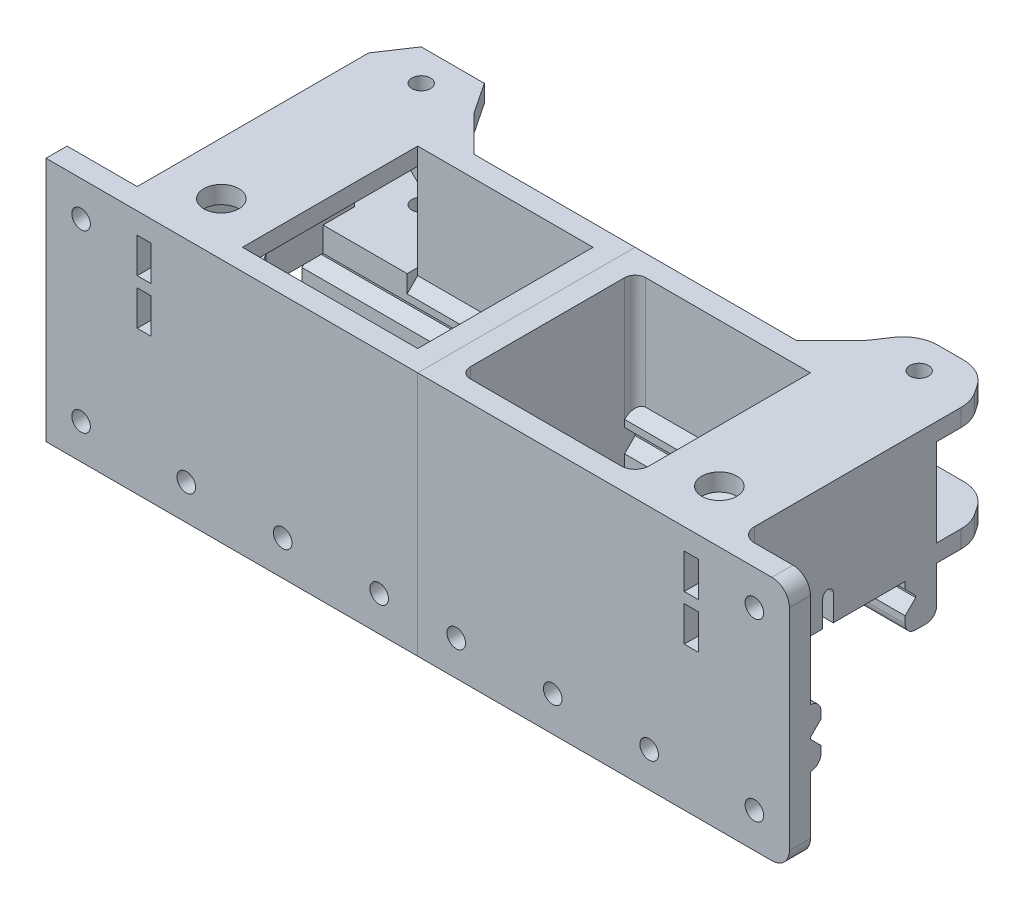
from build123d import *

# Parameters (mm, degrees)
SKETCH1_W                        = 50
SKETCH1_H                        = 70
BOSS_EXTRUDE1_DEPTH              = 6
SKETCH3_W                        = 4
SKETCH3_H                        = 10
CUT_EXTRUDE1_DEPTH               = 44.428101501
BOSS_EXTRUDE3_START              = -13
SKETCH4_R                        = 2.65
BOSS_EXTRUDE3_DEPTH              = 5
BOSS_EXTRUDE4_START              = -30
SKETCH4_3_R                      = 2.65
BOSS_EXTRUDE4_DEPTH              = 5
SKETCH5_R                        = 2.65
CUT_EXTRUDE2_DEPTH               = 47.626172907
SKETCH6_W                        = 4
SKETCH6_H                        = 10
CUT_EXTRUDE3_DEPTH               = 50.254441424
BOSS_EXTRUDE6_DEPTH              = 50
BOSS_EXTRUDE6_DIRECTION_2_REACH  = 65.632
BOSS_EXTRUDE7_DEPTH              = 70
SKETCH12_W                       = 62
SKETCH12_H                       = 16.5
BOSS_EXTRUDE8_DEPTH              = 6
SKETCH13_W                       = 6
SKETCH13_H                       = 3
BOSS_EXTRUDE9_DEPTH              = 48.5
SKETCH14_W                       = 50
SKETCH14_H                       = 6.5
CUT_EXTRUDE5_DEPTH               = 46
BOSS_EXTRUDE10_DEPTH             = 22
BOSS_EXTRUDE10_DEPTH_BACK        = 6
SKETCH15_W                       = 30
SKETCH15_H                       = 5
SKETCH16_R                       = 2.65
CUT_EXTRUDE6_DEPTH               = 38
SKETCH17_W                       = 4
SKETCH17_H                       = 24
CUT_EXTRUDE7_DEPTH               = 68
BOSS_EXTRUDE11_START             = 75
SKETCH19_W                       = 30
SKETCH19_H                       = 5
BOSS_EXTRUDE11_DEPTH             = 28
SKETCH20_R                       = 2.65
CUT_EXTRUDE9_DEPTH               = 116.805872045
SKETCH22_W                       = 30
SKETCH22_H                       = 47
BOSS_EXTRUDE12_DEPTH             = 5
SKETCH40_W                       = 4
SKETCH40_H                       = 1
CUT_EXTRUDE20_DEPTH              = 20
BOSS_EXTRUDE14_REACH             = 132.713
BOSS_EXTRUDE20_REACH             = 106.508
SKETCH41_W                       = 20
SKETCH41_H                       = 7
BOSS_EXTRUDE20_DIRECTION_2_REACH = 106.508
CHAMFER1_SIZE                    = 3
SKETCH34_W                       = 62
SKETCH34_H                       = 16
SKETCH34_R                       = 2.65
BOSS_EXTRUDE18_DEPTH             = 6
SKETCH35_W                       = 6
SKETCH35_H                       = 21.5
BOSS_EXTRUDE19_DEPTH             = 56
SKETCH46_W                       = 7.451156618
SKETCH46_H                       = 44
CUT_EXTRUDE22_DEPTH              = 10
SKETCH36_R                       = 2.65
CUT_EXTRUDE16_DEPTH              = 13
CHAMFER2_SIZE                    = 10
CHAMFER3_SIZE                    = 3
CHAMFER4_SIZE                    = 10
FILLET1_R                        = 10
SKETCH47_R                       = 5
CUT_EXTRUDE23_DEPTH              = 10
BOSS_EXTRUDE46_DEPTH             = 32
SKETCH79_R                       = 10.5
CUT_EXTRUDE30_DEPTH              = 12
FILLET6_R                        = 5
BOSS_EXTRUDE43_DEPTH             = 0.4
SKETCH82_W                       = 9
SKETCH82_H                       = 25
BOSS_EXTRUDE44_DEPTH             = 0.2
FILLET7_R                        = 3
CUT_EXTRUDE31_DEPTH              = 5.6
SKETCH84_W                       = 47
SKETCH84_H                       = 25
CUT_EXTRUDE32_DEPTH              = 2
BOSS_EXTRUDE45_DEPTH             = 0.4
SKETCH86_W                       = 44
SKETCH86_H                       = 2
CUT_EXTRUDE33_DEPTH              = 10.4
FILLET8_R                        = 10
FILLET9_R                        = 3
FILLET10_R                       = 4
CUT_EXTRUDE34_START              = -1
CUT_EXTRUDE34_DEPTH              = 1


with BuildPart() as part:
    # Sketch1 → Boss-Extrude1 (new body)
    with BuildSketch(Plane.XY):
        Rectangle(SKETCH1_W, SKETCH1_H)
    extrude(amount=BOSS_EXTRUDE1_DEPTH)

    # Sketch3 → Cut-Extrude1 (cut, through all)
    with BuildSketch(Plane.XY.offset(6)):
        with Locations((3, 24)):
            Rectangle(SKETCH3_W, SKETCH3_H)
    extrude(amount=-CUT_EXTRUDE1_DEPTH, mode=Mode.SUBTRACT)

    # Sketch4 → Boss-Extrude3 (add)
    # profile 1 of 2: a face of its own
    with BuildSketch(Plane(origin=(0, 35, 0), x_dir=(1, 0, 0), z_dir=(0, 1, 0)).offset(BOSS_EXTRUDE3_START)):
        with BuildLine():
            ThreePointArc((17.941176471, 13.235294118), (14.630461799, 16.717436331), (10, 18))
            ThreePointArc((10, 18), (5.369538201, 16.717436331), (2.058823529, 13.235294118))
            Line((2.058823529, 13.235294118), (-5, 0))
            Line((-5, 0), (25, 0))
            Line((25, 0), (17.941176471, 13.235294118))
        make_face()
        with Locations(Location((10, 9, 0), (0, 0, 270))):
            Circle(SKETCH4_R, mode=Mode.SUBTRACT)
    # profile 2 of 2: a face of its own
    with BuildSketch(Plane(origin=(0, 35, 0), x_dir=(1, 0, 0), z_dir=(0, 1, 0)).offset(BOSS_EXTRUDE3_START)):
        with BuildLine():
            ThreePointArc((2.058823529, 13.235294118), (5.369538201, 16.717436331), (10, 18))
            Line((10, 18), (-5, 18))
            Line((-5, 18), (-5, 0))
            Line((-5, 0), (2.058823529, 13.235294118))
        make_face()
    extrude(amount=-BOSS_EXTRUDE3_DEPTH)

    # Sketch4<3> → Boss-Extrude4 (add)
    # profile 1 of 2: a face of its own
    with BuildSketch(Plane(origin=(0, 35, 0), x_dir=(1, 0, 0), z_dir=(0, 1, 0)).offset(BOSS_EXTRUDE4_START)):
        with BuildLine():
            ThreePointArc((2.058823529, 13.235294118), (5.369538201, 16.717436331), (10, 18))
            Line((10, 18), (-5, 18))
            Line((-5, 18), (-5, 0))
            Line((-5, 0), (2.058823529, 13.235294118))
        make_face()
    # profile 2 of 2: a face of its own
    with BuildSketch(Plane(origin=(0, 35, 0), x_dir=(1, 0, 0), z_dir=(0, 1, 0)).offset(BOSS_EXTRUDE4_START)):
        with BuildLine():
            ThreePointArc((17.941176471, 13.235294118), (14.630461799, 16.717436331), (10, 18))
            ThreePointArc((10, 18), (5.369538201, 16.717436331), (2.058823529, 13.235294118))
            Line((2.058823529, 13.235294118), (-5, 0))
            Line((-5, 0), (25, 0))
            Line((25, 0), (17.941176471, 13.235294118))
        make_face()
        with Locations(Location((10, 9, 0), (0, 0, 270))):
            Circle(SKETCH4_3_R, mode=Mode.SUBTRACT)
    extrude(amount=-BOSS_EXTRUDE4_DEPTH)

    # Sketch5 → Cut-Extrude2 (cut, through all)
    with BuildSketch(Plane(origin=(0, 0, 0), x_dir=(-1, 0, 0), z_dir=(0, 0, -1))):
        with Locations((15, 25)):
            Circle(SKETCH5_R)
        with Locations((15, -25)):
            Circle(SKETCH5_R)
        with Locations((-15, -25)):
            Circle(SKETCH5_R)
    extrude(amount=-CUT_EXTRUDE2_DEPTH, mode=Mode.SUBTRACT)

    # Sketch6 → Cut-Extrude3 (cut, through all)
    with BuildSketch(Plane.XY.offset(6)):
        with Locations((3, 11)):
            Rectangle(SKETCH6_W, SKETCH6_H)
    extrude(amount=-CUT_EXTRUDE3_DEPTH, mode=Mode.SUBTRACT)

    # Sketch9 → Boss-Extrude6 (add)
    with BuildSketch(Plane(origin=(25, 0, 0), x_dir=(0, 0, -1), z_dir=(1, 0, 0))):
        Polygon((0, -2), (3, -2), (3, 3), (-6, 3), (-6, 8.003800923), (-6, 6.5), (-6, -13.5), (3, -13.5), (3, -8.5), (0, -8.5), align=None)
    extrude(amount=BOSS_EXTRUDE6_DEPTH)

    # Boss-Extrude6 direction 2: up to this face of the body (flat: up to its plane)
    boss_extrude6_direction_2_end = Plane(part.part.faces().sort_by_distance((-25, 0, 3))[0])
    # Sketch9 → Boss-Extrude6 direction 2 (add, up to the picked face)
    with BuildSketch(Plane(origin=(25, 0, 0), x_dir=(0, 0, -1), z_dir=(1, 0, 0)), mode=Mode.PRIVATE) as boss_extrude6_direction_2_sk1:
        Polygon((0, -2), (3, -2), (3, 3), (-6, 3), (-6, 8.003800923), (-6, 6.5), (-6, -13.5), (3, -13.5), (3, -8.5), (0, -8.5), align=None)
    boss_extrude6_direction_2_tool1 = split(extrude(boss_extrude6_direction_2_sk1.sketch, amount=-BOSS_EXTRUDE6_DIRECTION_2_REACH, mode=Mode.PRIVATE), bisect_by=boss_extrude6_direction_2_end, keep=Keep.BOTH, mode=Mode.PRIVATE)
    add(boss_extrude6_direction_2_tool1.solids().sort_by(Axis((25, -5.25, 1.953488), (-1, 0, 0)))[0])



with BuildPart() as body_2:
    # Sketch10 → Boss-Extrude7 (new body)
    with BuildSketch(Plane(origin=(75, 0, 0), x_dir=(0, 0, -1), z_dir=(1, 0, 0))):
        Polygon((47, 3), (56, 3), (56, -13.5), (47, -13.5), (47, -8.5), (50, -8.5), (50, -2), (47, -2), align=None)
    extrude(amount=-BOSS_EXTRUDE7_DEPTH)


with BuildPart() as part_1:
    add(part.part)

    add(body_2.part)  # Boss-Extrude8 merges body 2
    # Sketch12 → Boss-Extrude8 (add)
    with BuildSketch(Plane(origin=(75, 0, 0), x_dir=(0, 0, -1), z_dir=(1, 0, 0))):
        with Locations((25, -5.25)):
            Rectangle(SKETCH12_W, SKETCH12_H)
    extrude(amount=BOSS_EXTRUDE8_DEPTH)

    # Sketch13 → Boss-Extrude9 (add)
    with BuildSketch(Plane.XZ.offset(13.5)):
        Polygon((-5, 0), (1, 0), (1, -47), (5, -47), (5, -56), (-5, -56), align=None)
        with Locations((-2, -1.5)):
            Rectangle(SKETCH13_W, SKETCH13_H)
    extrude(amount=-BOSS_EXTRUDE9_DEPTH)

    # Sketch14 → Cut-Extrude5 (cut)
    with BuildSketch(Plane(origin=(5, 0, 0), x_dir=(0, 0, -1), z_dir=(1, 0, 0))):
        with Locations((25, -5.25)):
            Rectangle(SKETCH14_W, SKETCH14_H)
    extrude(amount=-CUT_EXTRUDE5_DEPTH, mode=Mode.SUBTRACT)

    # Sketch15 → Boss-Extrude10 (add, two sides: drawn at the far end of the back side and taken through both)
    with BuildSketch(Plane(origin=(0, 0, -56), x_dir=(-1, 0, 0), z_dir=(0, 0, -1)).offset(-BOSS_EXTRUDE10_DEPTH_BACK)):
        with Locations((-10, 2.5)):
            Rectangle(SKETCH15_W, SKETCH15_H)
    extrude(amount=BOSS_EXTRUDE10_DEPTH + BOSS_EXTRUDE10_DEPTH_BACK)

    # Sketch16 → Cut-Extrude6 (cut)
    with BuildSketch(Plane(origin=(0, 35, 0), x_dir=(1, 0, 0), z_dir=(0, 1, 0))):
        with Locations(Location((10, 66, 0), (0, 0, 270))):
            Circle(SKETCH16_R)
        Polygon((-11.950245161, 66), (-5, 66), (1, 75), (19, 75), (25, 66), (29.066568536, 63), (29.066568536, 83.252685977), (-11.950245161, 83.252685977), align=None)
    extrude(amount=-CUT_EXTRUDE6_DEPTH, mode=Mode.SUBTRACT)

    # Sketch17 → Cut-Extrude7 (cut)
    with BuildSketch(Plane(origin=(0, 0, 0), x_dir=(-1, 0, 0), z_dir=(0, 0, -1))):
        with Locations((-3, 18)):
            Rectangle(SKETCH17_W, SKETCH17_H)
    extrude(amount=CUT_EXTRUDE7_DEPTH, mode=Mode.SUBTRACT)

    # Sketch19 → Boss-Extrude11 (add)
    with BuildSketch(Plane(origin=(0, 0, 0), x_dir=(-1, 0, 0), z_dir=(0, 0, -1)).offset(BOSS_EXTRUDE11_START)):
        with Locations((-10, 32.5)):
            Rectangle(SKETCH19_W, SKETCH19_H)
    extrude(amount=-BOSS_EXTRUDE11_DEPTH)

    # Sketch20 → Cut-Extrude9 (cut, through all)
    with BuildSketch(Plane.XZ):
        with Locations(Location((10, -66, 0), (0, 0, 90))):
            Circle(SKETCH20_R)
        Polygon((-5, -66), (1, -75), (19, -75), (25, -66), (30.497094531, -66), (30.497094531, -85.505826408), (-19.333477305, -82.841089947), (-12.671636151, -66), align=None)
    extrude(amount=-CUT_EXTRUDE9_DEPTH, mode=Mode.SUBTRACT)

    # Sketch22 → Boss-Extrude12 (add)
    with BuildSketch(Plane(origin=(0, 35, 0), x_dir=(1, 0, 0), z_dir=(0, 1, 0))):
        with Locations((10, 23.5)):
            Rectangle(SKETCH22_W, SKETCH22_H)
    extrude(amount=-BOSS_EXTRUDE12_DEPTH)

    # Sketch40 → Cut-Extrude20 (cut)
    with BuildSketch(Plane(origin=(0, 0, -56), x_dir=(-1, 0, 0), z_dir=(0, 0, -1))):
        with Locations((-3, 5.5)):
            Rectangle(SKETCH40_W, SKETCH40_H)
    extrude(amount=-CUT_EXTRUDE20_DEPTH, mode=Mode.SUBTRACT)

    # Boss-Extrude14: up to this face of the body (flat: up to its plane)
    boss_extrude14_end = Plane(part_1.part.faces().sort_by_distance((-15, 3, -1.5))[0])
    # Sketch24 → Boss-Extrude14 (add, up to the picked face)
    with BuildSketch(Plane(origin=(0, 35, 0), x_dir=(1, 0, 0), z_dir=(0, 1, 0)), mode=Mode.PRIVATE) as boss_extrude14_sk1:
        Polygon((25, -6), (81, -6), (81, 56), (25, 56), (25, 53), (78, 53), (78, -3), (25, -3), align=None)
    boss_extrude14_tool1 = split(extrude(boss_extrude14_sk1.sketch, amount=-BOSS_EXTRUDE14_REACH, mode=Mode.PRIVATE), bisect_by=boss_extrude14_end, keep=Keep.BOTH, mode=Mode.PRIVATE)
    add(boss_extrude14_tool1.solids().sort_by(Axis((53, 35, 5.164536), (0, -1, 0)))[0])

    # Boss-Extrude20: up to this face of the body (flat: up to its plane)
    boss_extrude20_end = Plane(part_1.part.faces().sort_by_distance((37.259259259, 0.574074074, -47))[0])
    # Sketch41 → Boss-Extrude20 (add, up to the picked face)
    with BuildSketch(Plane.XY.offset(-50), mode=Mode.PRIVATE) as boss_extrude20_sk1:
        with Locations((15, 1.5)):
            Rectangle(SKETCH41_W, SKETCH41_H)
    boss_extrude20_tool1 = split(extrude(boss_extrude20_sk1.sketch, amount=BOSS_EXTRUDE20_REACH, mode=Mode.PRIVATE), bisect_by=boss_extrude20_end, keep=Keep.BOTH, mode=Mode.PRIVATE)
    add(boss_extrude20_tool1.solids().sort_by(Axis((15, 1.5, -50), (0, 0, 1)))[0])

    # Boss-Extrude20 direction 2: up to this face of the body (flat: up to its plane)
    boss_extrude20_direction_2_end = Plane(part_1.part.faces().sort_by_distance((-2, 17.5, -56))[0])
    # Sketch41 → Boss-Extrude20 direction 2 (add, up to the picked face)
    with BuildSketch(Plane.XY.offset(-50), mode=Mode.PRIVATE) as boss_extrude20_direction_2_sk1:
        with Locations((15, 1.5)):
            Rectangle(SKETCH41_W, SKETCH41_H)
    boss_extrude20_direction_2_tool1 = split(extrude(boss_extrude20_direction_2_sk1.sketch, amount=-BOSS_EXTRUDE20_DIRECTION_2_REACH, mode=Mode.PRIVATE), bisect_by=boss_extrude20_direction_2_end, keep=Keep.BOTH, mode=Mode.PRIVATE)
    add(boss_extrude20_direction_2_tool1.solids().sort_by(Axis((15, 1.5, -50), (0, 0, -1)))[0])

    # Chamfer1
    chamfer1_edges = [part_1.edges().sort_by_distance(p)[0] for p in [
        (25, -2, 0),
        (25, -8.5, 0),
        (49.2, 3, -3),
        (35, -2, -50),
        (35, -8.5, -50),
        (50, 3, -47),
    ]]
    chamfer(chamfer1_edges, length=CHAMFER1_SIZE)

    # Sketch34 → Boss-Extrude18 (add)
    with BuildSketch(Plane(origin=(81, 0, 0), x_dir=(0, 0, -1), z_dir=(1, 0, 0))):
        with Locations((25, -16.3)):
            Rectangle(SKETCH34_W, SKETCH34_H)
        with Locations(Location((25, -16.3, 0), (0, 0, 90))):
            Circle(SKETCH34_R, mode=Mode.SUBTRACT)
    extrude(amount=-BOSS_EXTRUDE18_DEPTH)

    # Sketch35 → Boss-Extrude19 (add)
    with BuildSketch(Plane(origin=(25, 0, 0), x_dir=(0, 0, -1), z_dir=(1, 0, 0))):
        with Locations((-3, -24.25)):
            Rectangle(SKETCH35_W, SKETCH35_H)
    extrude(amount=BOSS_EXTRUDE19_DEPTH)

    # Sketch46 → Cut-Extrude22 (cut)
    with BuildSketch(Plane.XZ.offset(13.5)):
        with Locations((-2.725578309, -25)):
            Rectangle(SKETCH46_W, SKETCH46_H)
    extrude(amount=-CUT_EXTRUDE22_DEPTH, mode=Mode.SUBTRACT)

    # Sketch36 → Cut-Extrude16 (cut)
    with BuildSketch(Plane(origin=(0, 0, 0), x_dir=(-1, 0, 0), z_dir=(0, 0, -1))):
        with BuildLine():
            ThreePointArc((-39.85, -25), (-42.5, -22.35), (-45.15, -25))
            Line((-45.15, -25), (-39.85, -25))
        make_face()
        with BuildLine():
            Line((-39.85, -25), (-45.15, -25))
            ThreePointArc((-45.15, -25), (-42.5, -27.65), (-39.85, -25))
        make_face()
        with Locations((-70, -25)):
            Circle(SKETCH36_R)
    extrude(amount=-CUT_EXTRUDE16_DEPTH, mode=Mode.SUBTRACT)

    # Chamfer2
    chamfer2_edges = [part_1.edges().sort_by_distance(p)[0] for p in [
        (25, 30, -54.5),
    ]]
    chamfer(chamfer2_edges, length=CHAMFER2_SIZE)

    # Chamfer3
    chamfer3_edges = [part_1.edges().sort_by_distance(p)[0] for p in [
        (25, 19, 3),
    ]]
    chamfer(chamfer3_edges, length=CHAMFER3_SIZE - 0.0001)  # a hair under: the kernel refuses the full size

    # Chamfer4
    # the kernel refuses this chamfer: 10 mm, written as the material it adds along each edge
    with BuildSketch(Plane(origin=(25, 0, -56), x_dir=(1, 0, 0), z_dir=(0, 1, 0))) as chamfer4_piece_1:
        Polygon((CHAMFER4_SIZE, 0), (0, CHAMFER4_SIZE), (0, 0), align=None)
    extrude(amount=5)
    with BuildSketch(Plane(origin=(25, -25.71682988, -56), x_dir=(1, 0, 0), z_dir=(0, 1, 0))) as chamfer4_piece_2_section:
        Polygon((CHAMFER4_SIZE, 0), (0, CHAMFER4_SIZE), (0, 0), align=None)
    chamfer4_piece_2 = extrude(amount=56.433659759, mode=Mode.PRIVATE)
    chamfer4_piece_2 = split(chamfer4_piece_2, bisect_by=Plane(origin=(25, 30, -56), z_dir=(0, 1, 0)), keep=Keep.TOP, mode=Mode.PRIVATE)
    add(chamfer4_piece_2)
    with BuildSketch(Plane(origin=(25, 35, -56), x_dir=(1, 0, 0), z_dir=(0, -1, 0))) as chamfer4_piece_3:
        Polygon((CHAMFER4_SIZE, 0), (0, -CHAMFER4_SIZE), (0, 0), align=None)
    extrude(amount=5)
    with BuildSketch(Plane(origin=(25, 60.71682988, -56), x_dir=(1, 0, 0), z_dir=(0, -1, 0))) as chamfer4_piece_4_section:
        Polygon((CHAMFER4_SIZE, 0), (0, -CHAMFER4_SIZE), (0, 0), align=None)
    chamfer4_piece_4 = extrude(amount=56.433659759, mode=Mode.PRIVATE)
    chamfer4_piece_4 = split(chamfer4_piece_4, bisect_by=Plane(origin=(25, 5, -56), z_dir=(0, -1, 0)), keep=Keep.TOP, mode=Mode.PRIVATE)
    add(chamfer4_piece_4)

    # Fillet1
    fillet1_edges = [part_1.edges().sort_by_distance(p)[0] for p in [
        (75, -13.5, -51.5),
    ]]
    fillet(fillet1_edges, radius=FILLET1_R)

    # Sketch47 → Cut-Extrude23 (cut)
    with BuildSketch(Plane(origin=(0, 35, 0), x_dir=(1, 0, 0), z_dir=(0, 1, 0))):
        with Locations(Location((10, 9, 0), (0, 0, 270))):
            Circle(SKETCH47_R)
    extrude(amount=-CUT_EXTRUDE23_DEPTH, mode=Mode.SUBTRACT)

    # Sketch89 → Boss-Extrude46 (add)
    with BuildSketch(Plane(origin=(0, 3, 0), x_dir=(1, 0, 0), z_dir=(0, 1, 0))):
        Polygon((75, 0), (25, 0), (28, -3), (78, -3), (78, 53), (25, 53), (25, 50), (75, 50), align=None)
    extrude(amount=BOSS_EXTRUDE46_DEPTH)


with BuildPart() as body_2_2:
    # Mirror1: mirrored copy
    add(part_1.part.mirror(Plane(origin=(81, 4.874203855, -24.516610226), x_dir=(0, 0, 1), z_dir=(1, 0, 0))))

    # Sketch79 → Cut-Extrude30 (cut)
    with BuildSketch(Plane.XZ.offset(-17)):
        with Locations((152, -9)):
            Circle(SKETCH79_R)
    extrude(amount=CUT_EXTRUDE30_DEPTH, mode=Mode.SUBTRACT)

    # Fillet6
    fillet6_edges = [body_2_2.edges().sort_by_distance(p)[0] for p in [
        (187, -35, 3),
        (187, 35, 3),
    ]]
    fillet(fillet6_edges, radius=FILLET6_R)

    # Sketch81 → Boss-Extrude43 (add)
    with BuildSketch(Plane.ZY.offset(-161)):
        Polygon((-47, 5), (-18, 5), (-18, 0), (-3, 0), (-3, -2), (-47, -2), align=None)
    extrude(amount=BOSS_EXTRUDE43_DEPTH)

    # Sketch82 → Boss-Extrude44 (add)
    with BuildSketch(Plane.ZY.offset(-161)):
        with Locations((-51.5, 17.5)):
            Rectangle(SKETCH82_W, SKETCH82_H)
    extrude(amount=BOSS_EXTRUDE44_DEPTH)

    # Fillet7
    fillet7_edges = [body_2_2.edges().sort_by_distance(p)[0] for p in [
        (157, 19.5, -18),
        (160.6, 2.5, -18),
    ]]
    fillet(fillet7_edges, radius=FILLET7_R)

    # Sketch83 → Cut-Extrude31 (cut)
    with BuildSketch(Plane(origin=(167, 0, 0), x_dir=(0, 0, -1), z_dir=(1, 0, 0))):
        with BuildLine():
            Line((26.5, 7.5), (26.5, -4.255908706))
            ThreePointArc((26.5, -4.255908706), (25, -5.755908706), (23.5, -4.255908706))
            Line((23.5, -4.255908706), (23.5, 7.5))
            ThreePointArc((23.5, 7.5), (25, 9), (26.5, 7.5))
        make_face()
    extrude(amount=-CUT_EXTRUDE31_DEPTH, mode=Mode.SUBTRACT)

    # Sketch84 → Cut-Extrude32 (cut)
    with BuildSketch(Plane.ZY.offset(-161)):
        with Locations((-23.5, 17.5)):
            Rectangle(SKETCH84_W, SKETCH84_H)
    extrude(amount=-CUT_EXTRUDE32_DEPTH, mode=Mode.SUBTRACT)

    # Sketch85 → Boss-Extrude45 (add)
    with BuildSketch(Plane.ZY.offset(-163)):
        with BuildLine():
            Line((-26.5, 5), (-23.5, 5))
            Line((-23.5, 5), (-23.5, 7.5))
            ThreePointArc((-23.5, 7.5), (-25, 9), (-26.5, 7.5))
            Line((-26.5, 7.5), (-26.5, 5))
        make_face()
    extrude(amount=-BOSS_EXTRUDE45_DEPTH)

    # Sketch86 → Cut-Extrude33 (cut)
    with BuildSketch(Plane.ZY.offset(-160.6)):
        with Locations((-25, -1)):
            Rectangle(SKETCH86_W, SKETCH86_H)
    extrude(amount=-CUT_EXTRUDE33_DEPTH, mode=Mode.SUBTRACT)

    # Fillet8
    fillet8_edges = [body_2_2.edges().sort_by_distance(p)[0] for p in [
        (137, 2.5, -66),
        (143, 2.5, -75),
        (161, 2.5, -75),
        (167, 2.5, -66),
        (167, 32.5, -66),
        (161, 32.5, -75),
        (143, 32.5, -75),
        (137, 32.5, -66),
        (137, 20, -54.5),
    ]]
    fillet(fillet8_edges, radius=FILLET8_R)

    # Fillet9
    # the kernel refuses this fillet: 3 mm, written as the material it adds along each edge
    with BuildSketch(Plane(origin=(81, -24.3, 0), x_dir=(0, -1, 0), z_dir=(1, 0, 0))) as fillet9_piece_1:
        with BuildLine():
            CenterArc((FILLET9_R, FILLET9_R), FILLET9_R, 180, 90)
            Line((0, FILLET9_R), (0, 0))
            Line((0, 0), (FILLET9_R, 0))
        make_face()
    extrude(amount=6)
    with BuildSketch(Plane(origin=(87, -4.5, 0), x_dir=(1, 0, 0), z_dir=(0, 1, 0))) as fillet9_piece_2_section:
        with BuildLine():
            CenterArc((FILLET9_R, FILLET9_R), FILLET9_R, 180, 90)
            Line((0, FILLET9_R), (0, 0))
            Line((0, 0), (FILLET9_R, 0))
        make_face()
    fillet9_piece_2 = extrude(amount=39.5, mode=Mode.PRIVATE)
    fillet9_piece_2 = split(fillet9_piece_2, bisect_by=Plane(origin=(87, -0.75, -3.75), z_dir=(0, 0.7071067811865476, -0.7071067811865476)), keep=Keep.TOP, mode=Mode.PRIVATE)
    add(fillet9_piece_2)
    with BuildSketch(Plane(origin=(87, -4.5, -50), x_dir=(1, 0, 0), z_dir=(0, 1, 0))) as fillet9_piece_3_section:
        with BuildLine():
            CenterArc((FILLET9_R, -FILLET9_R), FILLET9_R, 90, 90)
            Line((0, -FILLET9_R), (0, 0))
            Line((0, 0), (FILLET9_R, 0))
        make_face()
    fillet9_piece_3 = extrude(amount=39.5, mode=Mode.PRIVATE)
    fillet9_piece_3 = split(fillet9_piece_3, bisect_by=Plane(origin=(87, -4.75, -49.75), z_dir=(0, 0.7071067811865476, -0.7071067811865476)), keep=Keep.TOP, mode=Mode.PRIVATE)
    add(fillet9_piece_3)
    # the kernel refuses this fillet: 3 mm, written as the material it takes off along each edge
    with BuildSketch(Plane(origin=(87, -13.5, -3), x_dir=(0, 1, 0), z_dir=(1, 0, 0))) as fillet9_2_piece_1:
        with BuildLine():
            CenterArc((FILLET9_R, FILLET9_R), FILLET9_R, 180, 90)
            Line((0, FILLET9_R), (0, 0))
            Line((0, 0), (FILLET9_R, 0))
        make_face()
    extrude(amount=107.5, mode=Mode.SUBTRACT)
    with BuildSketch(Plane(origin=(167, 3, -3), x_dir=(0, -1, 0), z_dir=(1, 0, 0))) as fillet9_2_piece_2:
        with BuildLine():
            CenterArc((FILLET9_R, -FILLET9_R), FILLET9_R, 90, 90)
            Line((0, -FILLET9_R), (0, 0))
            Line((0, 0), (FILLET9_R, 0))
        make_face()
    extrude(amount=27.5, mode=Mode.SUBTRACT)
    with BuildSketch(Plane(origin=(97, -13.5, -47), x_dir=(0, 1, 0), z_dir=(1, 0, 0))) as fillet9_2_piece_3:
        with BuildLine():
            CenterArc((FILLET9_R, -FILLET9_R), FILLET9_R, 90, 90)
            Line((0, -FILLET9_R), (0, 0))
            Line((0, 0), (FILLET9_R, 0))
        make_face()
    extrude(amount=77.5, mode=Mode.SUBTRACT)
    with BuildSketch(Plane(origin=(73.5, -24.3, -56), x_dir=(0, 0, 1), z_dir=(1, 0, 0))) as fillet9_2_piece_4:
        with BuildLine():
            CenterArc((FILLET9_R, -FILLET9_R), FILLET9_R, 90, 90)
            Line((0, -FILLET9_R), (0, 0))
            Line((0, 0), (FILLET9_R, 0))
        make_face()
    extrude(amount=21, mode=Mode.SUBTRACT)
    with BuildSketch(Plane(origin=(174.5, -13.5, -56), x_dir=(0, 0, 1), z_dir=(-1, 0, 0))) as fillet9_2_piece_5:
        with BuildLine():
            CenterArc((FILLET9_R, FILLET9_R), FILLET9_R, 180, 90)
            Line((0, FILLET9_R), (0, 0))
            Line((0, 0), (FILLET9_R, 0))
        make_face()
    extrude(amount=77.5, mode=Mode.SUBTRACT)
    with BuildSketch(Plane(origin=(97, -23.5, -47), x_dir=(-0.7314834707826334, -0.6818591731228614, 0), z_dir=(0.6818591731228614, -0.7314834707826334, 0))) as fillet9_2_piece_6_section:
        with BuildLine():
            CenterArc((10 + FILLET9_R, FILLET9_R), FILLET9_R, 180, 90)
            Line((10 + FILLET9_R, 0), (10, 0))
            Line((10, 0), (10, FILLET9_R))
        make_face()
    fillet9_2_piece_6 = revolve(axis=Axis((97, -23.5, -47), (0, 0, -1)), revolution_arc=132.989096771, mode=Mode.PRIVATE)
    fillet9_2_piece_6 = split(fillet9_2_piece_6, bisect_by=Plane(origin=(87, -23.5, -47), z_dir=(1, 0, 0)), keep=Keep.TOP, mode=Mode.PRIVATE)
    add(fillet9_2_piece_6, mode=Mode.SUBTRACT)
    with BuildSketch(Plane(origin=(97, -23.5, -56), x_dir=(-1, 0, 0), z_dir=(0, -1, 0))) as fillet9_2_piece_7:
        with BuildLine():
            CenterArc((10 + FILLET9_R, -FILLET9_R), FILLET9_R, 90, 90)
            Line((10 + FILLET9_R, 0), (10, 0))
            Line((10, 0), (10, -FILLET9_R))
        make_face()
    revolve(axis=Axis((97, -23.5, -56), (0, 0, -1)), revolution_arc=90, mode=Mode.SUBTRACT)
    with BuildSketch(Plane(origin=(87, -31.8, -56), x_dir=(0, 0, 1), z_dir=(0, 1, 0))) as fillet9_2_piece_8:
        with BuildLine():
            CenterArc((FILLET9_R, -FILLET9_R), FILLET9_R, 90, 90)
            Line((0, -FILLET9_R), (0, 0))
            Line((0, 0), (FILLET9_R, 0))
        make_face()
    extrude(amount=8.3, mode=Mode.SUBTRACT)

    # Fillet10
    # the kernel refuses this fillet: 4 mm, written as the material it adds along each edge
    with BuildSketch(Plane(origin=(137, 5, 0), x_dir=(-1, 0, 0), z_dir=(0, -1, 0))) as fillet10_piece_1_section:
        with BuildLine():
            CenterArc((FILLET10_R * 0.6, FILLET10_R), FILLET10_R, 208.072486936, 61.927513064)
            Line((-FILLET10_R * 0.282352941176, FILLET10_R * 0.529411764706), (0, 0))
            Line((0, 0), (FILLET10_R * 0.6, 0))
        make_face()
    fillet10_piece_1 = extrude(amount=8, mode=Mode.PRIVATE)
    fillet10_piece_1 = split(fillet10_piece_1, bisect_by=Plane(origin=(137, 4, 1), z_dir=(0, 0.7071067811865476, -0.7071067811865476)), keep=Keep.TOP, mode=Mode.PRIVATE)
    add(fillet10_piece_1)
    with BuildSketch(Plane(origin=(167, 35, 0), x_dir=(0, 0, -1), z_dir=(0, -1, 0))) as fillet10_piece_2_section:
        with BuildLine():
            CenterArc((FILLET10_R, FILLET10_R), FILLET10_R, 180, 90)
            Line((0, FILLET10_R), (0, 0))
            Line((0, 0), (FILLET10_R, 0))
        make_face()
    fillet10_piece_2 = extrude(amount=42, mode=Mode.PRIVATE)
    fillet10_piece_2 = split(fillet10_piece_2, bisect_by=Plane(origin=(167, 0, 0), z_dir=(0, 1, 0)), keep=Keep.TOP, mode=Mode.PRIVATE)
    add(fillet10_piece_2)
    with BuildSketch(Plane(origin=(137, 22, 0), x_dir=(-1, 0, 0), z_dir=(0, -1, 0))) as fillet10_piece_3:
        with BuildLine():
            CenterArc((FILLET10_R * 0.6, FILLET10_R), FILLET10_R, 208.072486936, 61.927513064)
            Line((-FILLET10_R * 0.282352941176, FILLET10_R * 0.529411764706), (0, 0))
            Line((0, 0), (FILLET10_R * 0.6, 0))
        make_face()
    extrude(amount=5)
    with BuildSketch(Plane(origin=(137, 30, 0), x_dir=(-1, 0, 0), z_dir=(0, 1, 0))) as fillet10_piece_4:
        with BuildLine():
            CenterArc((FILLET10_R, -FILLET10_R), FILLET10_R, 90, 90)
            Line((0, -FILLET10_R), (0, 0))
            Line((0, 0), (FILLET10_R, 0))
        make_face()
    extrude(amount=5)
    with BuildSketch(Plane(origin=(137, -6.682458366, -50), x_dir=(0, 0, 1), z_dir=(0, 1, 0))) as fillet10_piece_5_section:
        with BuildLine():
            CenterArc((4, -3.872983346), FILLET10_R, 104.477512186, 75.522487814)
            Line((0, -3.872983346), (0, 0))
            Line((0, 0), (3, 0))
        make_face()
    fillet10_piece_5 = extrude(amount=11.682458366, mode=Mode.PRIVATE)
    fillet10_piece_5 = split(fillet10_piece_5, bisect_by=Plane(origin=(137, -1.841229183, -45.158770817), z_dir=(0, 0.7071067811865476, 0.7071067811865476)), keep=Keep.TOP, mode=Mode.PRIVATE)
    add(fillet10_piece_5)

    # Cut-Extrude34: read off the stored shape, not the designer's step
    # Cut-Extrude34 outline → Cut-Extrude34 (cut)
    with BuildSketch(Plane(origin=(0, 0, -56), x_dir=(-1, 0, 0), z_dir=(0, 0, -1)).offset(CUT_EXTRUDE34_START)):
        Polygon((-83.743268925, 15.062309788), (-83.720776874, 15.057200366), (-83.703314049, 15.058591059), (-82.904036578, 15.26416654), (-82.883710069, 15.273790607), (-82.868418394, 15.290281645), (-82.860353612, 15.311275666), (-82.860671807, 15.333763183), (-83.032301909, 16.160856818), (-83.04215439, 16.182310917), (-83.045791185, 16.187000031), (-83.063954893, 16.201945022), (-85.716066746, 17.524478888), (-85.729595549, 17.533756524), (-85.733229572, 17.538136072), (-85.735404684, 17.539866901), (-85.73664531, 17.542252555), (-85.740070802, 17.546380792), (-85.746693572, 17.561388855), (-85.748958749, 17.577636071), (-85.748958749, 24.098281208), (-85.753480305, 24.121012604), (-85.766356606, 24.140283351), (-85.785627353, 24.153159652), (-85.808358749, 24.157681208), (-86.949558749, 24.157681208), (-86.972290145, 24.153159652), (-86.991560892, 24.140283351), (-87.004437193, 24.121012604), (-87.008958749, 24.098281208), (-87.008958749, 18.237103427), (-87.010772005, 18.222538848), (-87.013210656, 18.217735462), (-87.014421029, 18.21222206), (-87.019238053, 18.205863356), (-87.02261665, 18.199208567), (-87.026615184, 18.196125187), (-87.029803275, 18.191916754), (-87.04210786, 18.184178359), (-87.043336504, 18.183230917), (-87.044331805, 18.182779712), (-87.060866216, 18.178177864), (-87.066264675, 18.178277758), (-87.068911353, 18.177705997), (-87.071770815, 18.178379644), (-87.078026138, 18.178495393), (-87.094378981, 18.183705791), (-89.040341022, 19.131957232), (-89.063039603, 19.137866651), (-89.0862561, 19.134528831), (-89.855412206, 18.861124304), (-89.873588393, 18.850750647), (-89.887038701, 18.834717065), (-89.894093502, 18.81501386), (-89.893877061, 18.794086852), (-89.750451446, 18.037842703), (-89.743096251, 18.021272523), (-89.739418683, 18.013029363), (-89.718572247, 17.995740036), (-87.041878248, 16.662675985), (-87.028338973, 16.653400173), (-87.01785478, 16.64077344), (-87.011226027, 16.625759703), (-87.008958749, 16.609505099), (-87.008958749, 9.630392533), (-87.003225936, 9.605815955), (-86.99867815, 9.599056844), (-86.987866105, 9.585889662), (-86.9763552, 9.578287199), (-86.970261299, 9.575048844), (-86.949049625, 9.570994715), (-85.807849625, 9.580776429), (-85.78431284, 9.586401287), (-85.777949018, 9.590249225), (-85.764784573, 9.601039346), (-85.758833482, 9.608549172), (-85.754617459, 9.616384643), (-85.751112157, 9.627205581), (-85.748958749, 9.640174247), (-85.748958749, 15.906736399), (-85.74709714, 15.921490841), (-85.741628999, 15.935320469), (-85.732897071, 15.947358435), (-85.721448678, 15.956850193), (-85.708001411, 15.963200796), (-85.693398149, 15.966012186), (-85.678554231, 15.965108143), (-85.664400082, 15.960545334), align=None)
        Polygon((-92.50268744, 24.152848863), (-92.543958749, 24.157681208), (-93.989358749, 24.157681208), (-94.036521876, 24.152988958), (-94.079353695, 24.138912209), (-94.11544529, 24.11728969), (-94.147758749, 24.087481208), (-100.971558749, 16.612081208), (-100.985353866, 16.602359301), (-101.004636216, 16.599638381), (-101.022939009, 16.606623501), (-101.035763866, 16.62159789), (-101.039958749, 16.640881208), (-100.987758749, 18.025081208), (-100.984654721, 18.051635038), (-100.977154023, 18.077173955), (-100.965475248, 18.100953682), (-100.949958749, 18.122281208), (-95.803758749, 24.083881208), (-95.781554823, 24.117054931), (-95.778184584, 24.130073305), (-95.779968828, 24.140712686), (-95.786841596, 24.148923914), (-95.798797506, 24.154789077), (-95.837958749, 24.159481208), (-97.232958749, 24.157681208), (-97.275085636, 24.15373924), (-97.31386185, 24.141913335), (-97.353875657, 24.118892231), (-97.389558749, 24.085681208), (-100.966158749, 19.983481208), (-100.982205631, 19.971558997), (-101.005164865, 19.967685044), (-101.0272973, 19.975442061), (-101.043190767, 19.992933183), (-101.048958749, 20.015881208), (-101.048958749, 24.067681208), (-101.054583749, 24.107056208), (-101.061614999, 24.122524958), (-101.071458749, 24.135181208), (-101.084114999, 24.145024958), (-101.099583749, 24.152056208), (-101.138958749, 24.157681208), (-102.218958749, 24.157681208), (-102.258333749, 24.152056208), (-102.273802499, 24.145024958), (-102.286458749, 24.135181208), (-102.296302499, 24.122524958), (-102.303333749, 24.107056208), (-102.308958749, 24.067681208), (-102.308958749, 9.667681208), (-102.303565491, 9.62967672), (-102.296823919, 9.614557622), (-102.287385719, 9.602027287), (-102.274675189, 9.591720403), (-102.259033851, 9.584227095), (-102.218958749, 9.577681208), (-101.146158749, 9.575881208), (-101.103633749, 9.581956208), (-101.086927499, 9.589549958), (-101.073258749, 9.600181208), (-101.062627499, 9.613849958), (-101.055033749, 9.630556208), (-101.048958749, 9.673081208), (-101.048958749, 14.567281208), (-101.045986844, 14.602679899), (-101.037071129, 14.635877179), (-101.02181875, 14.667528753), (-101.000358749, 14.696881208), (-92.509758749, 24.080281208), (-92.485564177, 24.114159176), (-92.481659992, 24.127466166), (-92.483217875, 24.138351828), (-92.49022744, 24.146808432), align=None)
        Polygon((-109.00685664, 24.153404173), (-109.028358749, 24.157681208), (-110.266534357, 24.157681208), (-110.289317473, 24.153138201), (-110.30861561, 24.140204091), (-110.321476863, 24.120857323), (-110.325933935, 24.09805724), (-110.301101338, 17.512097986), (-110.303409239, 17.495475835), (-110.310274012, 17.480162535), (-110.321147735, 17.467380342), (-110.335162502, 17.458149491), (-113.001104181, 16.200795731), (-113.023406086, 16.182550211), (-113.034497537, 16.155955971), (-113.160282994, 15.324465097), (-113.158051148, 15.299210011), (-113.155044297, 15.292160377), (-113.145353246, 15.276863361), (-113.137916166, 15.269224729), (-113.133625513, 15.266048636), (-113.115985906, 15.257960889), (-112.319342687, 15.058387743), (-112.299116002, 15.056922244), (-112.279898297, 15.062128852), (-110.397395017, 15.93596537), (-110.38329369, 15.940476826), (-110.377312941, 15.940834549), (-110.374829318, 15.941436738), (-110.372735349, 15.941108346), (-110.368514677, 15.941360795), (-110.353976128, 15.938562361), (-110.352715155, 15.937968631), (-110.351890166, 15.93783925), (-110.348668753, 15.93606338), (-110.340581256, 15.932255376), (-110.338207488, 15.930296392), (-110.33618434, 15.929181091), (-110.333649598, 15.926534933), (-110.329162223, 15.922831666), (-110.326141423, 15.918696732), (-110.323778506, 15.916229953), (-110.322589166, 15.91383433), (-110.320428439, 15.910876681), (-110.317534408, 15.903652803), (-110.31580355, 15.90016643), (-110.315583539, 15.89878318), (-110.314922495, 15.897133129), (-110.312986449, 15.882454834), (-110.274323266, 9.638350786), (-110.271062165, 9.622379987), (-110.268229516, 9.613564432), (-110.260775439, 9.602476803), (-110.255367843, 9.595652408), (-110.243062404, 9.587440813), (-110.236801648, 9.583674893), (-110.215088266, 9.579318807), (-109.02852261, 9.576045522), (-109.007847944, 9.580106115), (-109.002069134, 9.582964217), (-108.991345655, 9.590102704), (-108.979643513, 9.603496219), (-108.975100067, 9.610280762), (-108.968958749, 9.635445296), (-108.968958749, 16.600741545), (-108.966714839, 16.616913784), (-108.960152644, 16.631864169), (-108.949767954, 16.644463163), (-108.936345357, 16.653758879), (-106.250107065, 18.010960532), (-106.22895496, 18.029156087), (-106.227937537, 18.030932462), (-106.218015862, 18.056118901), (-106.118852427, 18.799031849), (-106.119667402, 18.819423449), (-106.127336014, 18.838335719), (-106.140953073, 18.853536286), (-106.158911246, 18.863230901), (-106.956756943, 19.129731227), (-106.981525593, 19.131996168), (-106.995116169, 19.128736074), (-107.001889522, 19.126644826), (-108.883245162, 18.197033804), (-108.897454368, 18.192133867), (-108.901884958, 18.191785987), (-108.9042236, 18.19112757), (-108.906962399, 18.191387319), (-108.912438584, 18.190957342), (-108.92396831, 18.193000166), (-108.925920241, 18.193185288), (-108.927238412, 18.193579559), (-108.94090626, 18.199832624), (-108.943598704, 18.202022356), (-108.945414342, 18.202929952), (-108.947405787, 18.205118608), (-108.952567017, 18.209316173), (-108.95823466, 18.217019858), (-108.960081658, 18.219049762), (-108.960610675, 18.220249431), (-108.961474075, 18.221422998), (-108.964858271, 18.229881835), (-108.966696393, 18.2340502), (-108.966787473, 18.234703897), (-108.967057142, 18.235377936), (-108.968958749, 18.250287491), (-108.968958749, 24.098281208), (-108.972416232, 24.115663149), (-108.975496629, 24.124030246), (-108.982946077, 24.135179133), (-108.988408759, 24.141654556), (-109.000649518, 24.149833569), align=None)
        Polygon((-120.276969032, 24.153607787), (-120.314358749, 24.157681208), (-122.200758749, 24.157681208), (-122.239551144, 24.152175319), (-122.254979862, 24.145292957), (-122.267763594, 24.13565765), (-122.278267092, 24.122693951), (-122.285900784, 24.106743311), (-122.292558749, 24.065881208), (-122.348358749, 9.674881208), (-122.342514993, 9.633725183), (-122.335210298, 9.617367661), (-122.324983725, 9.6038238), (-122.311260529, 9.592730402), (-122.294381968, 9.584675504), (-122.251158749, 9.577681208), (-121.126158749, 9.575881208), (-121.083633749, 9.581956208), (-121.066927499, 9.589549958), (-121.053258749, 9.600181208), (-121.042627499, 9.613849958), (-121.035033749, 9.630556208), (-121.028958749, 9.673081208), (-121.028958749, 22.267681208), (-121.026793909, 22.29965354), (-121.020349743, 22.330686093), (-121.009776144, 22.360057046), (-120.995319054, 22.387083229), (-120.977314747, 22.411136009), (-120.956182005, 22.431655916), (-120.932412378, 22.448165655), (-120.906558749, 22.460281208), (-120.889693898, 22.459678099), (-120.869301569, 22.447394401), (-120.844923186, 22.423595438), (-120.816558749, 22.388281208), (-120.356541858, 21.757895263), (-119.906902002, 21.120316147), (-119.519225891, 20.552438187), (-119.139609979, 19.978973044), (-118.768054265, 19.399920717), (-118.404558749, 18.815281208), (-118.352134809, 18.723393731), (-118.309876083, 18.635341312), (-118.277782571, 18.55112395), (-118.255854274, 18.470741648), (-118.244091192, 18.394194403), (-118.242493324, 18.321482216), (-118.25106067, 18.252605088), (-118.26979323, 18.187563018), (-118.292958749, 18.136681208), (-118.705946249, 17.359081208), (-119.111508749, 16.576081208), (-119.509646249, 15.787681208), (-119.900358749, 14.993881208), (-119.912945573, 14.957218787), (-119.916902241, 14.918755757), (-119.91202135, 14.880508277), (-119.898558749, 14.844481208), (-117.232758749, 9.631681208), (-117.209367908, 9.596980158), (-117.179889938, 9.572496788), (-117.142982609, 9.557919767), (-117.099558749, 9.554281208), (-115.817958749, 9.610081208), (-115.777961711, 9.617915035), (-115.764617688, 9.625671081), (-115.755709996, 9.635986549), (-115.751263776, 9.648705362), (-115.751156494, 9.66392741), (-115.763958749, 9.701881208), (-118.184958749, 14.579881208), (-118.222333253, 14.668485729), (-118.248737981, 14.761006208), (-118.26378868, 14.856096255), (-118.26726633, 14.952372089), (-118.259120321, 15.04843267), (-118.239469197, 15.142880091), (-118.208598928, 15.234339922), (-118.166958749, 15.321481208), (-117.873896249, 15.857768708), (-117.581508749, 16.419031208), (-117.289796249, 17.005268708), (-116.998758749, 17.616481208), (-116.959231663, 17.706672998), (-116.924823736, 17.796928778), (-116.895534967, 17.887248547), (-116.871365357, 17.977632305), (-116.852314906, 18.068080053), (-116.838383613, 18.158591791), (-116.829571479, 18.249167518), (-116.825878503, 18.339807234), (-116.829811418, 18.474125517), (-116.844966366, 18.608584075), (-116.871343347, 18.743182909), (-116.908942361, 18.877922018), (-116.957763408, 19.012801402), (-117.017806489, 19.147821062), (-117.089071602, 19.282980997), (-117.171558749, 19.418281208), (-118.683558749, 21.750631208), (-120.188358749, 24.089281208), (-120.213754281, 24.119815813), (-120.243867127, 24.141387524), align=None)
        Polygon((-129.402061569, 24.154041621), (-129.420395311, 24.157681208), (-130.649958749, 24.157681208), (-130.663451554, 24.154997322), (-130.671876257, 24.152733741), (-130.682134301, 24.145879534), (-130.688702345, 24.141027129), (-130.696317252, 24.129630616), (-130.699946853, 24.123850371), (-130.703958749, 24.103681208), (-130.703958749, 18.362296208), (-130.705997775, 18.347597324), (-130.710173537, 18.338081502), (-130.710633166, 18.336290648), (-130.711245902, 18.335637771), (-130.711960867, 18.334008492), (-130.721397696, 18.322555934), (-130.727475718, 18.318344738), (-130.729006496, 18.316713678), (-130.730559152, 18.316208361), (-130.733595597, 18.314104541), (-130.747633391, 18.309292558), (-130.752650784, 18.309018562), (-130.754536841, 18.308404738), (-130.756624674, 18.308801551), (-130.76245095, 18.308483384), (-130.776929261, 18.311738126), (-130.779549275, 18.313158598), (-130.780913084, 18.313417803), (-130.789974928, 18.318810989), (-132.783014079, 19.786194625), (-132.803290368, 19.794938479), (-132.819148824, 19.796552116), (-133.714077314, 19.728096766), (-133.731362615, 19.723440144), (-133.735829199, 19.721115883), (-133.747150361, 19.712743597), (-133.750263861, 19.709850136), (-133.759537203, 19.69507271), (-133.763958749, 19.674254056), (-133.763958749, 18.873298823), (-133.758107952, 18.848851854), (-133.741823406, 18.829702451), (-131.208545714, 16.978125776), (-131.206378683, 16.976456057), (-131.205007275, 16.974687976), (-131.197751301, 16.967638372), (-131.192701173, 16.958822389), (-131.191336683, 16.957063227), (-131.191139393, 16.956095997), (-131.1902705, 16.954579176), (-131.186475294, 16.937176578), (-131.186769003, 16.934669884), (-131.186431591, 16.933015697), (-131.187389311, 16.929375789), (-131.188548099, 16.919485974), (-131.19173784, 16.912848795), (-131.192676626, 16.909280847), (-131.194411029, 16.907286451), (-131.196263398, 16.90343206), (-131.208781784, 16.890761465), (-133.741587335, 15.060447749), (-133.758041717, 15.041256794), (-133.763958749, 15.01667981), (-133.763958749, 14.176681208), (-133.75921103, 14.155788902), (-133.756277735, 14.150344796), (-133.746220844, 14.137660086), (-133.741581811, 14.13336326), (-133.733348694, 14.12878239), (-133.725637235, 14.12536037), (-133.709958749, 14.122681208), (-132.809659089, 14.122681208), (-132.790384729, 14.126630211), (-132.777692929, 14.133159206), (-130.789924909, 15.593140546), (-130.776878387, 15.600195686), (-130.762404544, 15.603435223), (-130.747595304, 15.602614761), (-130.733567896, 15.597796198), (-130.721380565, 15.589343051), (-130.711952738, 15.577893038), (-130.705995663, 15.56430996), (-130.703958749, 15.549618544), (-130.703958749, 9.631681208), (-130.698988983, 9.610147429), (-130.695491909, 9.604303539), (-130.685738994, 9.592254159), (-130.678821091, 9.586750409), (-130.671653247, 9.582856502), (-130.661742358, 9.579654015), (-130.649958749, 9.577681208), (-129.404438548, 9.577681208), (-129.390291074, 9.58049803), (-129.382054065, 9.582937388), (-129.371857217, 9.589758875), (-129.365465147, 9.594667519), (-129.357914387, 9.605990639), (-129.354392466, 9.611748448), (-129.350438607, 9.631760948), (-129.359200671, 15.565430951), (-129.357180114, 15.58014434), (-129.353164816, 15.589323027), (-129.352683558, 15.591228021), (-129.352014148, 15.591953373), (-129.351227831, 15.593750839), (-129.341794055, 15.60522125), (-129.336164515, 15.609127563), (-129.334638318, 15.610781304), (-129.332172318, 15.611897729), (-129.329592358, 15.613687952), (-129.323905075, 15.615640536), (-129.319795777, 15.617500926), (-129.317756609, 15.617751454), (-129.315545675, 15.618510522), (-129.30837634, 15.618903895), (-129.303624595, 15.619487684), (-129.302264245, 15.619239258), (-129.3007165, 15.619324181), (-129.291994415, 15.617363788), (-129.287596894, 15.616560715), (-129.286979789, 15.61623669), (-129.286226513, 15.616067383), (-129.273171736, 15.608986472), (-127.241532678, 14.112259976), (-127.226293987, 14.10468602), (-127.220705168, 14.103434449), (-127.20752432, 14.101772046), (-126.345979385, 14.133373115), (-126.325930001, 14.138034349), (-126.30908147, 14.149859404), (-126.297881942, 14.167130059), (-126.293958749, 14.187336826), (-126.293958749, 15.01876055), (-126.29911788, 15.040385687), (-126.301595467, 15.045289149), (-126.315969665, 15.062265705), (-128.80505041, 16.892472136), (-128.805656457, 16.892924329), (-128.806760389, 16.894261767), (-128.817976843, 16.906000695), (-128.819718882, 16.909961259), (-128.821512344, 16.912134076), (-128.822417616, 16.916096892), (-128.825510417, 16.923128446), (-128.826532994, 16.934111898), (-128.827059537, 16.936416831), (-128.826833326, 16.937337749), (-128.826980919, 16.93892304), (-128.823798515, 16.954463436), (-128.821655914, 16.958415315), (-128.821117786, 16.960606067), (-128.819335552, 16.96269506), (-128.816237826, 16.968408599), (-128.804951289, 16.979555154), (-126.316068785, 18.800901244), (-126.300468017, 18.819262772), (-126.298173651, 18.826856261), (-126.293958749, 18.844479108), (-126.293958749, 19.678891987), (-126.297343329, 19.696615673), (-126.299282698, 19.701188851), (-126.307149298, 19.71356851), (-126.309461249, 19.716495846), (-126.323511508, 19.726682903), (-126.344652695, 19.732790688), (-127.24249219, 19.787862627), (-127.261336825, 19.785680002), (-127.278263733, 19.777114731), (-129.262420259, 18.284289459), (-129.279424749, 18.275700942), (-129.282176818, 18.275540838), (-129.28475536, 18.274399005), (-129.294914532, 18.274799809), (-129.304242783, 18.274257129), (-129.30657233, 18.275259737), (-129.309163361, 18.27536196), (-129.325047049, 18.282648569), (-129.326148031, 18.283684883), (-129.32707768, 18.284084993), (-129.329005367, 18.28637439), (-129.337772011, 18.294626114), (-129.340927609, 18.300533715), (-129.343089792, 18.303101609), (-129.343733498, 18.305786625), (-129.34600559, 18.310040212), (-129.3488855, 18.327276579), (-129.366395559, 24.103844893), (-129.372715256, 24.127682402), (-129.376821482, 24.133802671), (-129.389226373, 24.146559832), (-129.397492772, 24.152069683), align=None)
    extrude(amount=CUT_EXTRUDE34_DEPTH, mode=Mode.SUBTRACT)


solid = Compound([part_1.part, body_2_2.part])
